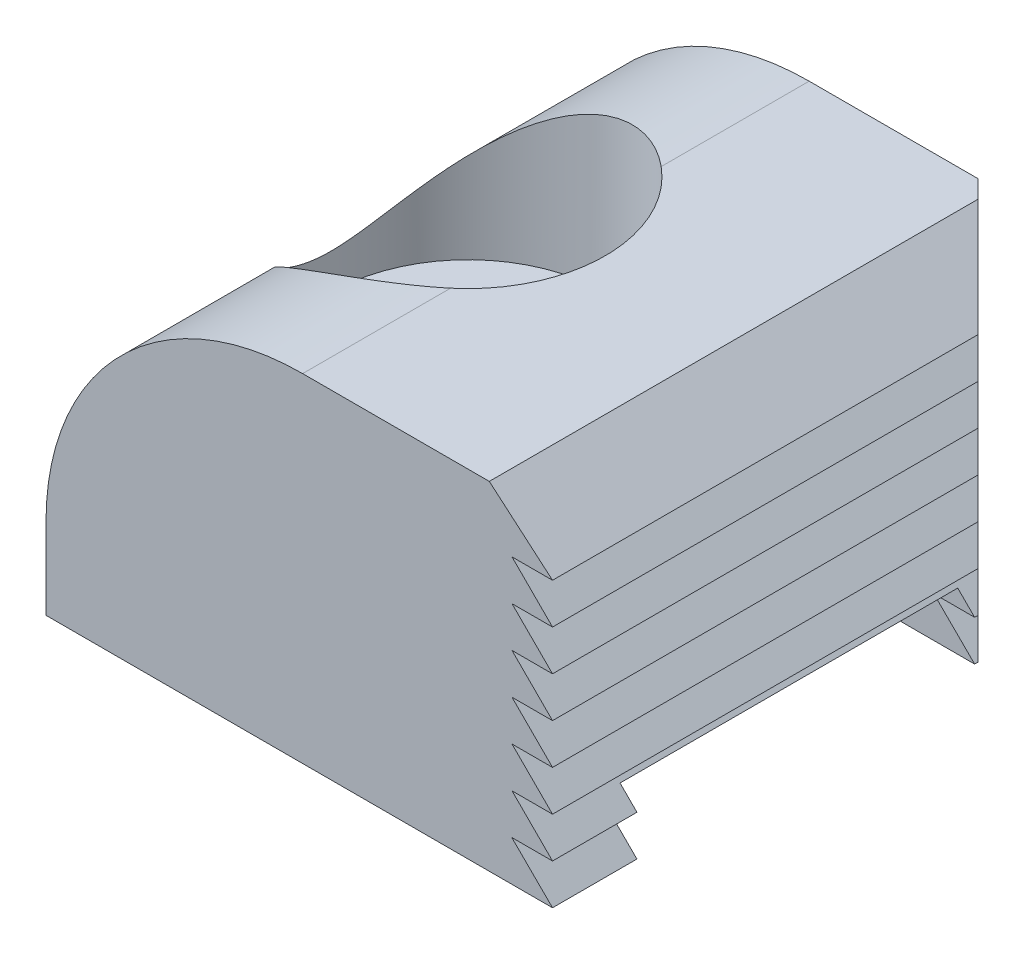
from build123d import *

# Parameters (mm, degrees)
CROQUIS1_W              = 19.05
CROQUIS1_H              = 12.7
SALIENTE_EXTRUIR1_DEPTH = 19.05
CROQUIS2_W              = 12.7
CROQUIS2_H              = 2.159
CORTAR_EXTRUIR1_DEPTH   = 23.235007389
CHAFL_N1_SIZE           = 3.048
CROQUIS9_R              = 5.1562
CORTAR_EXTRUIR4_DEPTH   = 6.35
CROQUIS17_R             = 3.2639
CORTAR_EXTRUIR5_DEPTH   = 25.797542721
REDONDEO1_START         = -9.525
REDONDEO1_DEPTH         = 19.05
CORTAR_EXTRUIR6_DEPTH   = 28.687044486
CORTAR_EXTRUIR7_DEPTH   = 28.687044486
CORTAR_EXTRUIR8_DEPTH   = 28.687044486
CORTAR_EXTRUIR9_DEPTH   = 28.687044486
CORTAR_EXTRUIR10_DEPTH  = 28.687044486
CORTAR_EXTRUIR11_DEPTH  = 28.687044486
CORTAR_EXTRUIR12_DEPTH  = 28.687044486
CORTAR_EXTRUIR13_DEPTH  = 28.687044486


with BuildPart() as part:
    # Croquis1 → Saliente-Extruir1 (new body)
    with BuildSketch(Plane(origin=(0, 0, 0), x_dir=(0, 0, -1), z_dir=(1, 0, 0))):
        with Locations((0, -0.034937632)):
            Rectangle(CROQUIS1_W, CROQUIS1_H)
    extrude(amount=SALIENTE_EXTRUIR1_DEPTH)

    # Croquis2 → Cortar-Extruir1 (cut, through all)
    with BuildSketch(Plane.ZY):
        with Locations((0, -5.305437632)):
            Rectangle(CROQUIS2_W, CROQUIS2_H)
    extrude(amount=-CORTAR_EXTRUIR1_DEPTH, mode=Mode.SUBTRACT)

    # Chaflán1
    chafl_n1_edges = [part.edges().sort_by_distance(p)[0] for p in [
        (19.05, -0.034937632, -9.525),
    ]]
    chamfer(chafl_n1_edges, length=CHAFL_N1_SIZE)

    # Croquis9 → Cortar-Extruir4 (cut)
    with BuildSketch(Plane(origin=(0, 6.315062368, 0), x_dir=(1, 0, 0), z_dir=(0, 1, 0))):
        with Locations(Location((6.35, 0, 0), (0, 0, 270))):
            Circle(CROQUIS9_R)
    extrude(amount=-CORTAR_EXTRUIR4_DEPTH, mode=Mode.SUBTRACT)

    # Croquis17 → Cortar-Extruir5 (cut, through all)
    with BuildSketch(Plane(origin=(0, 6.315062368, 0), x_dir=(1, 0, 0), z_dir=(0, 1, 0))):
        with Locations(Location((6.35, 0, 0), (0, 0, 270))):
            Circle(CROQUIS17_R)
    extrude(amount=-CORTAR_EXTRUIR5_DEPTH, mode=Mode.SUBTRACT)

    # Redondeo1: read off the stored shape, not the designer's step
    # Redondeo1 outline → Redondeo1 (cut)
    with BuildSketch(Plane.XY.offset(REDONDEO1_START)):
        with BuildLine():
            ThreePointArc((0, -3.336937632), (2.827005348, 3.48805702), (9.652, 6.315062368))
            Line((9.652, 6.315062368), (0, 6.315062368))
            Line((0, 6.315062368), (0, -3.336937632))
        make_face()
    extrude(amount=REDONDEO1_DEPTH, mode=Mode.SUBTRACT)

    # Croquis20 → Cortar-Extruir6 (cut, through all)
    with BuildSketch(Plane.XY.offset(9.525)):
        Polygon((19.05, -6.384937632), (19.05, -4.860937632), (17.517257595, -4.860937632), align=None)
    extrude(amount=-CORTAR_EXTRUIR6_DEPTH, mode=Mode.SUBTRACT)

    # Croquis21 → Cortar-Extruir7 (cut, through all)
    with BuildSketch(Plane.XY.offset(9.525)):
        Polygon((19.05, -4.860937632), (19.05, -3.336937632), (17.526, -3.336937632), align=None)
    extrude(amount=-CORTAR_EXTRUIR7_DEPTH, mode=Mode.SUBTRACT)

    # Croquis22 → Cortar-Extruir8 (cut, through all)
    with BuildSketch(Plane.XY.offset(9.525)):
        Polygon((19.05, -3.336937632), (19.05, -1.812937632), (17.526, -1.812937632), align=None)
    extrude(amount=-CORTAR_EXTRUIR8_DEPTH, mode=Mode.SUBTRACT)

    # Croquis23 → Cortar-Extruir9 (cut, through all)
    with BuildSketch(Plane.XY.offset(9.525)):
        Polygon((19.05, -1.812937632), (19.05, -0.288937632), (17.526, -0.288937632), align=None)
    extrude(amount=-CORTAR_EXTRUIR9_DEPTH, mode=Mode.SUBTRACT)

    # Croquis24 → Cortar-Extruir10 (cut, through all)
    with BuildSketch(Plane.XY.offset(9.525)):
        Polygon((19.05, -0.288937632), (19.05, 1.235062368), (17.526, 1.235062368), align=None)
    extrude(amount=-CORTAR_EXTRUIR10_DEPTH, mode=Mode.SUBTRACT)

    # Croquis25 → Cortar-Extruir11 (cut, through all)
    with BuildSketch(Plane.XY.offset(9.525)):
        Polygon((19.05, 1.235062368), (19.05, 2.759062368), (17.526, 2.759062368), align=None)
    extrude(amount=-CORTAR_EXTRUIR11_DEPTH, mode=Mode.SUBTRACT)

    # Croquis26 → Cortar-Extruir12 (cut, through all)
    with BuildSketch(Plane.XY.offset(9.525)):
        Polygon((19.05, 2.759062368), (19.05, 4.283062368), (17.526, 4.283062368), align=None)
    extrude(amount=-CORTAR_EXTRUIR12_DEPTH, mode=Mode.SUBTRACT)

    # Croquis27 → Cortar-Extruir13 (cut, through all)
    with BuildSketch(Plane.XY.offset(9.525)):
        Polygon((19.05, 4.283062368), (16.672562903, 6.315062368), (19.05, 6.315062368), align=None)
    extrude(amount=-CORTAR_EXTRUIR13_DEPTH, mode=Mode.SUBTRACT)


solid = part.part
